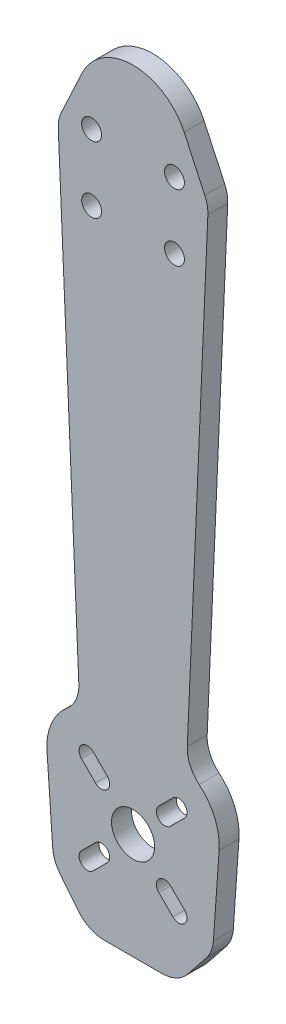
from build123d import *

# Parameters (mm, degrees)
SKETCH1_R   = 3.25
SKETCH1_R_2 = 1.5
ARM_DEPTH   = 3


with BuildPart() as part:
    # Sketch1 → arm (new body)
    with BuildSketch(Plane.XY):
        with BuildLine():
            Line((8.181538342, 15.560412846), (11.282357346, 86.580844321))
            ThreePointArc((11.282357346, 86.580844321), (11.19104264, 87.774392868), (10.818655174, 88.912032567))
            Line((10.818655174, 88.912032567), (7.70361619, 95.592255225))
            ThreePointArc((7.70361619, 95.592255225), (0, 100.5), (-7.70361619, 95.592255225))
            Line((-7.70361619, 95.592255225), (-10.818655174, 88.912032567))
            ThreePointArc((-10.818655174, 88.912032567), (-11.19104264, 87.774392868), (-11.282357346, 86.580844321))
            Line((-11.282357346, 86.580844321), (-8.181538342, 15.560412846))
            ThreePointArc((-8.181538342, 15.560412846), (-8.600305132, 13.328393664), (-9.963157432, 11.511828536))
            ThreePointArc((-9.963157432, 11.511828536), (-12.324154236, 8.321537367), (-12.979294427, 4.407069973))
            Line((-12.979294427, 4.407069973), (-12.122281745, -7.848782369))
            ThreePointArc((-12.122281745, -7.848782369), (-11.79450084, -9.312190191), (-11.047502278, -10.612573183))
            Line((-11.047502278, -10.612573183), (-8.26347657, -14.112573183))
            ThreePointArc((-8.26347657, -14.112573183), (-6.522662073, -15.503491197), (-4.350435786, -16))
            Line((-4.350435786, -16), (4.350435786, -16))
            ThreePointArc((4.350435786, -16), (6.522662073, -15.503491197), (8.26347657, -14.112573183))
            Line((8.26347657, -14.112573183), (11.047502278, -10.612573183))
            ThreePointArc((11.047502278, -10.612573183), (11.79450084, -9.312190191), (12.122281745, -7.848782369))
            Line((12.122281745, -7.848782369), (12.979294427, 4.407069973))
            ThreePointArc((12.979294427, 4.407069973), (12.324154236, 8.321537367), (9.963157432, 11.511828536))
            ThreePointArc((9.963157432, 11.511828536), (8.600305132, 13.328393664), (8.181538342, 15.560412846))
        make_face()
        Circle(SKETCH1_R, mode=Mode.SUBTRACT)
        with Locations((6.25, 89)):
            Circle(SKETCH1_R_2, mode=Mode.SUBTRACT)
        with Locations((6.25, 79)):
            Circle(SKETCH1_R_2, mode=Mode.SUBTRACT)
        with Locations((-6.25, 89)):
            Circle(SKETCH1_R_2, mode=Mode.SUBTRACT)
        with Locations((-6.25, 79)):
            Circle(SKETCH1_R_2, mode=Mode.SUBTRACT)
        with BuildLine():
            Line((7.778174593, 6.01040764), (5.656854249, 3.889087297))
            ThreePointArc((5.656854249, 3.889087297), (3.889087297, 3.889087297), (3.889087297, 5.656854249))
            Line((3.889087297, 5.656854249), (6.01040764, 7.778174593))
            ThreePointArc((6.01040764, 7.778174593), (7.778174593, 7.778174593), (7.778174593, 6.01040764))
        make_face(mode=Mode.SUBTRACT)
        with BuildLine():
            Line((-5.656854249, 3.889087297), (-7.778174593, 6.01040764))
            ThreePointArc((-7.778174593, 6.01040764), (-7.778174593, 7.778174593), (-6.01040764, 7.778174593))
            Line((-6.01040764, 7.778174593), (-3.889087297, 5.656854249))
            ThreePointArc((-3.889087297, 5.656854249), (-3.889087297, 3.889087297), (-5.656854249, 3.889087297))
        make_face(mode=Mode.SUBTRACT)
        with BuildLine():
            Line((-3.889087297, -5.656854249), (-6.01040764, -7.778174593))
            ThreePointArc((-6.01040764, -7.778174593), (-7.778174593, -7.778174593), (-7.778174593, -6.01040764))
            Line((-7.778174593, -6.01040764), (-5.656854249, -3.889087297))
            ThreePointArc((-5.656854249, -3.889087297), (-3.889087297, -3.889087297), (-3.889087297, -5.656854249))
        make_face(mode=Mode.SUBTRACT)
        with BuildLine():
            Line((6.01040764, -7.778174593), (3.889087297, -5.656854249))
            ThreePointArc((3.889087297, -5.656854249), (3.889087297, -3.889087297), (5.656854249, -3.889087297))
            Line((5.656854249, -3.889087297), (7.778174593, -6.01040764))
            ThreePointArc((7.778174593, -6.01040764), (7.778174593, -7.778174593), (6.01040764, -7.778174593))
        make_face(mode=Mode.SUBTRACT)
    extrude(amount=-ARM_DEPTH)


solid = part.part
